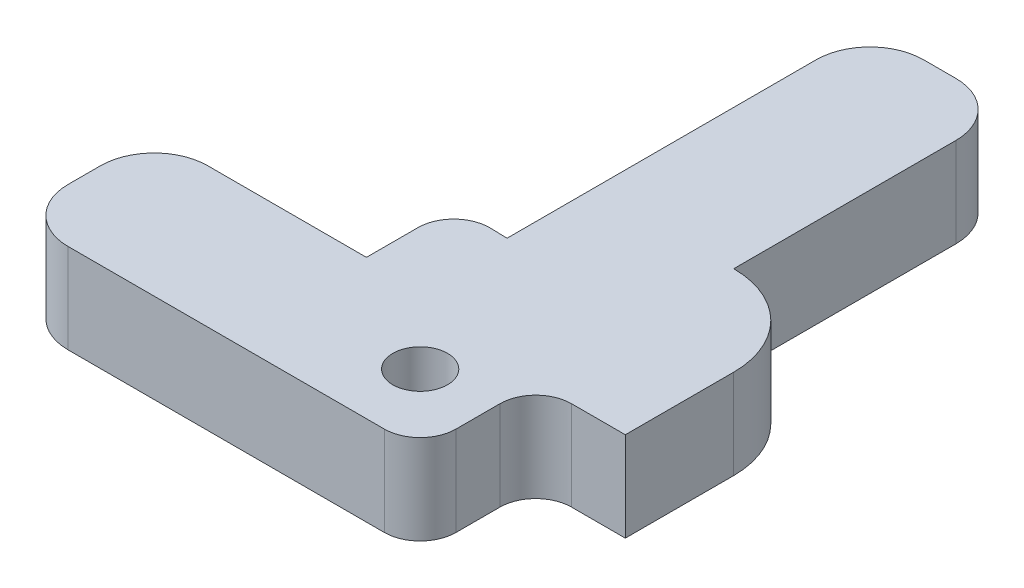
from build123d import *

# Parameters (mm, degrees)
SKETCH_1_R      = 1.525
EXTRUDE_1_DEPTH = 5
EXTRUDE_START   = -4
EXTRUDE_4_DEPTH = 4
FILLET_1_R      = 2
FILLET_2_R      = 5
FILLET_3_R      = 2


with BuildPart() as part:
    # 草图1 → 凸台-拉伸1 (new body)
    with BuildSketch(Plane(origin=(0, 0, 0), x_dir=(1, 0, 0), z_dir=(0, 1, 0))):
        with BuildLine():
            Line((3.9, -3.732227301), (3.9, 2.55))
            Line((3.9, 2.55), (5.747877547, 2.55))
            Line((5.747877547, 2.55), (8.9, 2.55))
            Line((8.9, 2.55), (8.9, 13.6))
            Line((8.9, 13.6), (3.9, 13.6))
            Line((3.9, 13.6), (3.9, 13.765734151))
            Line((3.9, 13.765734151), (3.9, 26))
            ThreePointArc((3.9, 26), (3.021320344, 28.121320344), (0.9, 29))
            Line((0.9, 29), (-0.9, 29))
            ThreePointArc((-0.9, 29), (-3.021320344, 28.121320344), (-3.9, 26))
            Line((-3.9, 26), (-3.9, 8.75))
            Line((-3.9, 8.75), (-4.851185593, 8.773222699))
            ThreePointArc((-4.851185593, 8.773222699), (-6.29684845, 8.205186518), (-6.9, 6.773818499))
            Line((-6.9, 6.773818499), (-6.9, 3.9))
            Line((-6.9, 3.9), (-15.75, 3.9))
            ThreePointArc((-15.75, 3.9), (-17.871320344, 3.021320344), (-18.75, 0.9))
            Line((-18.75, 0.9), (-18.75, -0.9))
            ThreePointArc((-18.75, -0.9), (-17.871320344, -3.021320344), (-15.75, -3.9))
            Line((-15.75, -3.9), (0, -3.9))
            Line((0, -3.9), (3.9, -3.9))
            Line((3.9, -3.9), (3.9, -3.732227301))
        make_face()
        with Locations(Location((0, 0, 0), (0, 0, 270))):
            Circle(SKETCH_1_R, mode=Mode.SUBTRACT)
    extrude(amount=EXTRUDE_1_DEPTH)

    # 草图4 → 凸台-拉伸4 (add)
    with BuildSketch(Plane(origin=(0, 0, 0), x_dir=(1, 0, 0), z_dir=(0, 1, 0)).offset(EXTRUDE_START)):
        with BuildLine():
            Line((-6.9, 3.9), (-3.9, 3.9))
            Line((-3.9, 3.9), (-3.9, 8.75))
            Line((-3.9, 8.75), (-4.851185593, 8.773222699))
            ThreePointArc((-4.851185593, 8.773222699), (-6.29684845, 8.205186518), (-6.9, 6.773818499))
            Line((-6.9, 6.773818499), (-6.9, 3.9))
        make_face()
    extrude(amount=EXTRUDE_4_DEPTH)

    # 圆角1
    fillet_1_edges = [part.edges().sort_by_distance(p)[0] for p in [
        (3.9, 2.5, 3.9),
    ]]
    fillet(fillet_1_edges, radius=FILLET_1_R)

    # 圆角2
    fillet_2_edges = [part.edges().sort_by_distance(p)[0] for p in [
        (8.9, 2.5, -13.6),
    ]]
    fillet(fillet_2_edges, radius=FILLET_2_R - 0.0001)  # a hair under: the kernel refuses the full size

    # 圆角3
    fillet_3_edges = [part.edges().sort_by_distance(p)[0] for p in [
        (3.9, 2.5, -2.55),
    ]]
    fillet(fillet_3_edges, radius=FILLET_3_R)


solid = part.part
